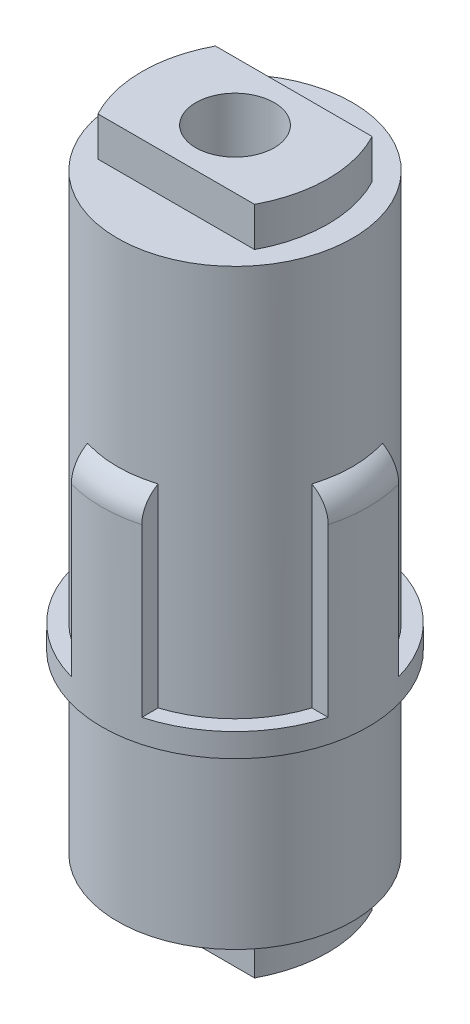
from build123d import *
from build123d.topology import SkipClean

# Parameters (mm, degrees)
SKETCH1_R            = 7.25
BOSS_EXTRUDE1_DEPTH  = 25
SKETCH2_R            = 2.1
BOSS_EXTRUDE2_DEPTH  = 2.5
SKETCH4_R            = 8.5
BOSS_EXTRUDE3_DEPTH  = 1.5
BOSS_EXTRUDE5_DEPTH  = 12.5
FILLET2_R            = 2
BOSS_EXTRUDE6_START  = 11.25
SKETCH6_R            = 7.25
BOSS_EXTRUDE6_DEPTH  = 11.25
BOSS_EXTRUDE7_START  = 2.5
SKETCH7_R            = 2.1
BOSS_EXTRUDE7_DEPTH  = 2.5
SKETCH8_R            = 2.1
CUT_EXTRUDE1_DEPTH   = 53.5
BOSS_EXTRUDE8_START  = 11.25
SKETCH9_R            = 7.5
SKETCH9_R_2          = 7.25
BOSS_EXTRUDE8_DEPTH  = 11.25
SKETCH10_R           = 7.5
SKETCH10_R_2         = 7.25
BOSS_EXTRUDE9_DEPTH  = 25
SKETCH11_R           = 2.15
CUT_EXTRUDE2_DEPTH   = 50
SKETCH12_R           = 6.607325953
CUT_EXTRUDE3_DEPTH   = 2.5
SKETCH13_R           = 6.756490311
CUT_EXTRUDE4_DEPTH   = 2.5
SKETCH14_W           = 10
SKETCH14_H           = 7.5
SKETCH14_R           = 2.15
BOSS_EXTRUDE10_DEPTH = 2.5
BOSS_EXTRUDE11_START = 2.5
SKETCH15_R           = 2.5
BOSS_EXTRUDE11_DEPTH = 2.5
SKETCH16_R           = 2.5
CUT_EXTRUDE5_DEPTH   = 61.5


with BuildPart() as part:
    # Sketch1 → Boss-Extrude1 (new body)
    with BuildSketch(Plane(origin=(0, 0, 0), x_dir=(1, 0, 0), z_dir=(0, 1, 0))):
        with Locations(Location((0, 0, 0), (0, 0, 270))):
            Circle(SKETCH1_R)
    extrude(amount=BOSS_EXTRUDE1_DEPTH)

    # Sketch2 → Boss-Extrude2 (add)
    with BuildSketch(Plane(origin=(0, 25, 0), x_dir=(1, 0, 0), z_dir=(0, 1, 0))):
        with BuildLine():
            Line((-4.9, -3.65), (4.9, -3.65))
            ThreePointArc((4.9, -3.65), (5.781186897, 0), (4.9, 3.65))
            Line((4.9, 3.65), (-4.9, 3.65))
            ThreePointArc((-4.9, 3.65), (-5.781186897, 0), (-4.9, -3.65))
        make_face()
        with Locations(Location((0, 0, 0), (0, 0, 270))):
            Circle(SKETCH2_R, mode=Mode.SUBTRACT)
    extrude(amount=BOSS_EXTRUDE2_DEPTH)

    # Sketch4 → Boss-Extrude3 (add)
    with BuildSketch(Plane(origin=(0, 0, 0), x_dir=(-1, 0, 0), z_dir=(0, -1, 0))):
        with Locations(Location((0, 0, 0), (0, 0, 90))):
            Circle(SKETCH4_R)
    extrude(amount=BOSS_EXTRUDE3_DEPTH)

    # Sketch5 → Boss-Extrude5 (add)
    with SkipClean():  # the faces are left unmerged after this step: merging them gives an invalid solid
        with BuildSketch(Plane(origin=(0, 0, 0), x_dir=(1, 0, 0), z_dir=(0, 1, 0))):
            with BuildLine():
                Line((-2.25, 8.196798155), (-2.25, 6.892024376))
                ThreePointArc((-2.25, 6.892024376), (0, 7.25), (2.25, 6.892024376))
                Line((2.25, 6.892024376), (2.25, 8.196798155))
                ThreePointArc((2.25, 8.196798155), (0, 8.5), (-2.25, 8.196798155))
            make_face()
            with BuildLine():
                Line((6.892024376, 2.25), (8.196798155, 2.25))
                ThreePointArc((8.196798155, 2.25), (8.5, 0), (8.196798155, -2.25))
                Line((8.196798155, -2.25), (6.892024376, -2.25))
                ThreePointArc((6.892024376, -2.25), (7.25, 0), (6.892024376, 2.25))
            make_face()
            with BuildLine():
                Line((2.25, -8.196798155), (2.25, -6.892024376))
                ThreePointArc((2.25, -6.892024376), (0, -7.25), (-2.25, -6.892024376))
                Line((-2.25, -6.892024376), (-2.25, -8.196798155))
                ThreePointArc((-2.25, -8.196798155), (0, -8.5), (2.25, -8.196798155))
            make_face()
            with BuildLine():
                Line((-6.892024376, -2.25), (-8.196798155, -2.25))
                ThreePointArc((-8.196798155, -2.25), (-8.5, 0), (-8.196798155, 2.25))
                Line((-8.196798155, 2.25), (-6.892024376, 2.25))
                ThreePointArc((-6.892024376, 2.25), (-7.25, 0), (-6.892024376, -2.25))
            make_face()
        extrude(amount=BOSS_EXTRUDE5_DEPTH)

    # Fillet2
    # the kernel refuses this fillet: 2 mm, written as the material it takes off along each edge
    with BuildSketch(Plane(origin=(0, 12.5, 0), x_dir=(-0.6871531367836845, 0, 0.72651260595281), z_dir=(0.72651260595281, 0, 0.6871531367836845))) as fillet2_piece_1:
        with BuildLine():
            CenterArc((6.5, 1.854049622), FILLET2_R, 292.024312837, 67.975687163)
            Line((7.25, 0), (7.265, -0.037080992))
            ThreePointArc((7.265, -0.037080992), (7.875, -0.04), (8.5, -0.04))
            Line((8.5, -0.04), (8.54, 0))
            Line((8.54, 0), (8.54, 1.854049622))
            Line((8.54, 1.854049622), (8.5, 1.854049622))
        make_face()
    revolve(axis=Axis((0, 12.5, 0), (0, -1, 0)), revolution_arc=93.189649372, mode=Mode.SUBTRACT)
    with BuildSketch(Plane(origin=(0, 12.5, 0), x_dir=(0.7265126059528094, 0, -0.687153136783685), z_dir=(0.687153136783685, 0, 0.7265126059528094))) as fillet2_piece_2:
        with BuildLine():
            CenterArc((6.5, -1.854049622), FILLET2_R, 0, 67.975687163)
            Line((7.25, 0), (7.265, 0.037080992))
            ThreePointArc((7.265, 0.037080992), (7.875, 0.04), (8.5, 0.04))
            Line((8.5, 0.04), (8.54, 0))
            Line((8.54, 0), (8.54, -1.854049622))
            Line((8.54, -1.854049622), (8.5, -1.854049622))
        make_face()
    revolve(axis=Axis((0, 12.5, 0), (0, 1, 0)), revolution_arc=93.189649372, mode=Mode.SUBTRACT)
    with BuildSketch(Plane(origin=(0, 12.5, 0), x_dir=(0.687153136783685, 0, -0.7265126059528094), z_dir=(-0.7265126059528094, 0, -0.687153136783685))) as fillet2_piece_3:
        with BuildLine():
            CenterArc((6.5, 1.854049622), FILLET2_R, 292.024312837, 67.975687163)
            Line((7.25, 0), (7.265, -0.037080992))
            ThreePointArc((7.265, -0.037080992), (7.875, -0.04), (8.5, -0.04))
            Line((8.5, -0.04), (8.54, 0))
            Line((8.54, 0), (8.54, 1.854049622))
            Line((8.54, 1.854049622), (8.5, 1.854049622))
        make_face()
    revolve(axis=Axis((0, 12.5, 0), (0, -1, 0)), revolution_arc=93.189649372, mode=Mode.SUBTRACT)
    with BuildSketch(Plane(origin=(0, 12.5, 0), x_dir=(-0.7265126059528072, 0, 0.6871531367836876), z_dir=(-0.6871531367836876, 0, -0.7265126059528072))) as fillet2_piece_4:
        with BuildLine():
            CenterArc((6.5, -1.854049622), FILLET2_R, 0, 67.975687163)
            Line((7.25, 0), (7.265, 0.037080992))
            ThreePointArc((7.265, 0.037080992), (7.875, 0.04), (8.5, 0.04))
            Line((8.5, 0.04), (8.54, 0))
            Line((8.54, 0), (8.54, -1.854049622))
            Line((8.54, -1.854049622), (8.5, -1.854049622))
        make_face()
    revolve(axis=Axis((0, 12.5, 0), (0, 1, 0)), revolution_arc=93.189649372, mode=Mode.SUBTRACT)

    # Sketch6 → Boss-Extrude6 (add)
    with BuildSketch(Plane(origin=(0, -1.5, 0), x_dir=(-1, 0, 0), z_dir=(0, -1, 0)).offset(BOSS_EXTRUDE6_START)):
        with Locations(Location((0, 0, 0), (0, 0, 108.080012624))):
            Circle(SKETCH6_R)
    extrude(amount=-BOSS_EXTRUDE6_DEPTH)

    # Sketch7 → Boss-Extrude7 (add)
    with BuildSketch(Plane(origin=(0, -12.75, 0), x_dir=(-1, 0, 0), z_dir=(0, -1, 0)).offset(BOSS_EXTRUDE7_START)):
        with BuildLine():
            Line((4.9, 3.65), (-4.9, 3.65))
            ThreePointArc((-4.9, 3.65), (-5.781186897, 0), (-4.9, -3.65))
            Line((-4.9, -3.65), (4.9, -3.65))
            ThreePointArc((4.9, -3.65), (5.781186897, 0), (4.9, 3.65))
        make_face()
        with Locations(Location((0, 0, 0), (0, 0, 270))):
            Circle(SKETCH7_R, mode=Mode.SUBTRACT)
    extrude(amount=-BOSS_EXTRUDE7_DEPTH)

    # Sketch8 → Cut-Extrude1 (cut)
    with BuildSketch(Plane(origin=(0, -12.75, 0), x_dir=(-1, 0, 0), z_dir=(0, -1, 0))):
        with Locations(Location((0, 0, 0), (0, 0, 90))):
            Circle(SKETCH8_R)
    extrude(amount=-CUT_EXTRUDE1_DEPTH, mode=Mode.SUBTRACT)

    # Sketch9 → Boss-Extrude8 (add)
    with BuildSketch(Plane.XZ.offset(1.5).offset(BOSS_EXTRUDE8_START)):
        with Locations(Location((0, 0, 0), (0, 0, 270))):
            Circle(SKETCH9_R)
        with Locations(Location((0, 0, 0), (0, 0, 288.080012624))):
            Circle(SKETCH9_R_2, mode=Mode.SUBTRACT)
    extrude(amount=-BOSS_EXTRUDE8_DEPTH)

    # Sketch10 → Boss-Extrude9 (add)
    with BuildSketch(Plane(origin=(0, 0, 0), x_dir=(1, 0, 0), z_dir=(0, 1, 0))):
        with Locations(Location((0, 0, 0), (0, 0, 90))):
            Circle(SKETCH10_R)
        Circle(SKETCH10_R_2, mode=Mode.SUBTRACT)
    extrude(amount=BOSS_EXTRUDE9_DEPTH)

    # Sketch11 → Cut-Extrude2 (cut)
    with BuildSketch(Plane(origin=(0, 27.5, 0), x_dir=(1, 0, 0), z_dir=(0, 1, 0))):
        with Locations(Location((0, 0, 0), (0, 0, 270))):
            Circle(SKETCH11_R)
    extrude(amount=-CUT_EXTRUDE2_DEPTH, mode=Mode.SUBTRACT)

    # Sketch12 → Cut-Extrude3 (cut)
    with BuildSketch(Plane(origin=(0, -15.25, 0), x_dir=(-1, 0, 0), z_dir=(0, -1, 0))):
        Circle(SKETCH12_R)
    extrude(amount=-CUT_EXTRUDE3_DEPTH, mode=Mode.SUBTRACT)

    # Sketch13 → Cut-Extrude4 (cut)
    with BuildSketch(Plane(origin=(0, 27.5, 0), x_dir=(1, 0, 0), z_dir=(0, 1, 0))):
        Circle(SKETCH13_R)
    extrude(amount=-CUT_EXTRUDE4_DEPTH, mode=Mode.SUBTRACT)

    # Sketch14 → Boss-Extrude10 (add)
    # profile 1 of 3: a face of its own
    with BuildSketch(Plane(origin=(0, -12.75, 0), x_dir=(-1, 0, 0), z_dir=(0, -1, 0))):
        Rectangle(SKETCH14_W, SKETCH14_H)
        with Locations(Location((0, 0, 0), (0, 0, 270))):
            Circle(SKETCH14_R, mode=Mode.SUBTRACT)
    # profile 2 of 3: a face of its own
    with BuildSketch(Plane(origin=(0, -12.75, 0), x_dir=(-1, 0, 0), z_dir=(0, -1, 0))):
        with BuildLine():
            Line((5, 3.75), (5, -3.75))
            ThreePointArc((5, -3.75), (5.933352987, 0), (5, 3.75))
        make_face()
    # profile 3 of 3: a face of its own
    with BuildSketch(Plane(origin=(0, -12.75, 0), x_dir=(-1, 0, 0), z_dir=(0, -1, 0))):
        with BuildLine():
            ThreePointArc((-5, -3.75), (-5.933352987, 0), (-5, 3.75))
            Line((-5, 3.75), (-5, -3.75))
        make_face()
    extrude(amount=BOSS_EXTRUDE10_DEPTH)

    # Sketch15 → Boss-Extrude11 (add)
    with BuildSketch(Plane(origin=(0, 25, 0), x_dir=(1, 0, 0), z_dir=(0, 1, 0)).offset(BOSS_EXTRUDE11_START)):
        with BuildLine():
            Line((-5, -3.75), (5, -3.75))
            ThreePointArc((5, -3.75), (5.933352987, 0), (5, 3.75))
            Line((5, 3.75), (-5, 3.75))
            ThreePointArc((-5, 3.75), (-5.933352987, 0), (-5, -3.75))
        make_face()
        with Locations(Location((0, 0, 0), (0, 0, 270))):
            Circle(SKETCH15_R, mode=Mode.SUBTRACT)
    extrude(amount=-BOSS_EXTRUDE11_DEPTH)

    # Sketch16 → Cut-Extrude5 (cut)
    with BuildSketch(Plane(origin=(0, 25, 0), x_dir=(1, 0, 0), z_dir=(0, 1, 0))):
        with Locations(Location((0, 0, 0), (0, 0, 90))):
            Circle(SKETCH16_R)
    extrude(amount=-CUT_EXTRUDE5_DEPTH, mode=Mode.SUBTRACT)


solid = part.part
